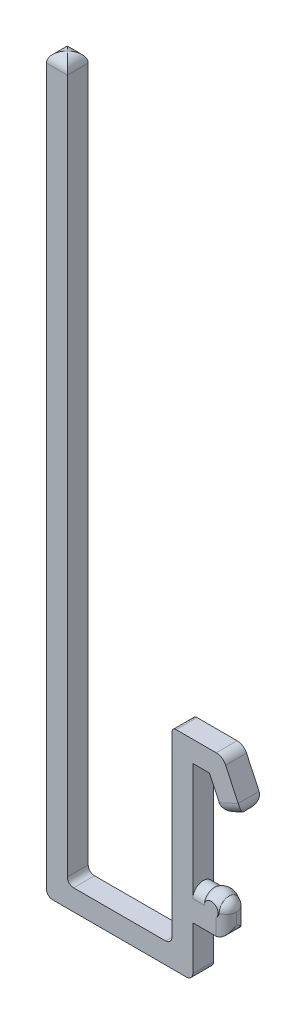
from build123d import *

# Parameters (mm, degrees)
EXTRUDE_1_DEPTH     = 5
FILLET_1_R          = 2.5
FILLET_2_R          = 1
EXTRUDE_2_DEPTH     = 8
FILLET_3_R          = 2.5
SKETCH_5_W          = 1.467751534
SKETCH_5_H          = 4.178210798
SKETCH_5_W_2        = 1.389566385
CUT_EXTRUDE_1_DEPTH = 20
FILLET_4_R          = 1.5
FILLET_5_R          = 1.5


with BuildPart() as part:
    # 草图1 → 凸台-拉伸1 (new body)
    with BuildSketch(Plane.XY):
        Polygon((0, 0), (0, 28), (4, 28), (7.380946094, 20.749537704), (11.912485029, 22.862629012), (7.185351304, 33), (-5, 33), (-5, -12), (-30, -12), (-30, 158), (-35, 158), (-35, -17), (0, -17), (0, -5), (8, -5), (8, 0), align=None)
    extrude(amount=EXTRUDE_1_DEPTH)

    # 圆角1
    fillet_1_edges = [part.edges().sort_by_distance(p)[0] for p in [
        (-32.5, 158, 0),
        (9.646715562, 21.806083358, 0),
        (9.646715562, 21.806083358, 5),
        (-35, 158, 2.5),
        (-30, 158, 2.5),
        (7.185351304, 33, 2.5),
        (11.912485029, 22.862629012, 2.5),
        (7.380946094, 20.749537704, 2.5),
        (-32.5, 158, 5),
    ]]
    fillet(fillet_1_edges, radius=FILLET_1_R - 0.0001)  # a hair under: the kernel refuses the full size

    # 圆角2
    fillet_2_edges = [part.edges().sort_by_distance(p)[0] for p in [
        (-5, 33, 2.5),
    ]]
    fillet(fillet_2_edges, radius=FILLET_2_R)

    # 草图3 → 凸台-拉伸2 (add)
    with BuildSketch(Plane(origin=(0, 0, 0), x_dir=(0, 0, -1), z_dir=(1, 0, 0))):
        with BuildLine():
            Line((-5, 0), (0, 0))
            ThreePointArc((0, 0), (-2.5, 2.5), (-5, 0))
        make_face()
    extrude(amount=EXTRUDE_2_DEPTH)

    # 圆角3
    fillet_3_edges = [part.edges().sort_by_distance(p)[0] for p in [
        (8, -2.5, 0),
        (8, -5, 2.5),
        (8, -2.5, 5),
        (8, 2.5, 2.5),
    ]]
    fillet(fillet_3_edges, radius=FILLET_3_R - 0.0001)  # a hair under: the kernel refuses the full size

    # 草图4 → 旋转3 (revolve)
    with BuildSketch(Plane(origin=(4.4, 0, 0), x_dir=(0, 0, -1), z_dir=(1, 0, 0))):
        with BuildLine():
            Line((-5.5, 0), (0.5, 0))
            ThreePointArc((0.5, 0), (-2.5, 3), (-5.5, 0))
        make_face()
    revolve(axis=Axis((4.4, 0, 2.5), (0, 0, -1)))

    # 草图5 → 切除-拉伸1 (cut)
    with BuildSketch(Plane.ZY.offset(5)):
        with Locations((-0.733875767, -0.010051234)):
            Rectangle(SKETCH_5_W, SKETCH_5_H)
        with Locations((5.694783193, -0.010051234)):
            Rectangle(SKETCH_5_W_2, SKETCH_5_H)
    extrude(amount=-CUT_EXTRUDE_1_DEPTH, mode=Mode.SUBTRACT)

    # 圆角4
    fillet_4_edges = [part.edges().sort_by_distance(p)[0] for p in [
        (-30, -12, 2.5),
        (-5, -12, 2.5),
    ]]
    fillet(fillet_4_edges, radius=FILLET_4_R)

    # 圆角5
    fillet_5_edges = [part.edges().sort_by_distance(p)[0] for p in [
        (0, -17, 2.5),
        (-35, -17, 2.5),
    ]]
    fillet(fillet_5_edges, radius=FILLET_5_R)


solid = part.part
